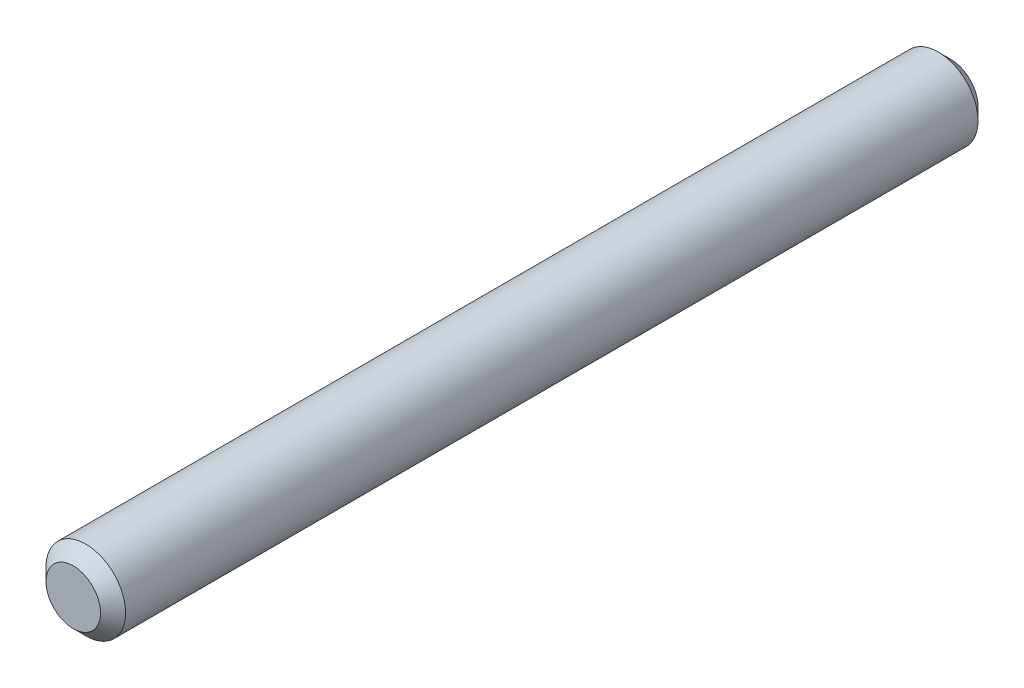
from build123d import *

# Parameters (mm, degrees)
SKETCH1_R           = 3.175
BOSS_EXTRUDE1_DEPTH = 70
CHAMFER1_SIZE       = 1


with BuildPart() as part:
    # Sketch1 → Boss-Extrude1 (new body)
    with BuildSketch(Plane.XY):
        Circle(SKETCH1_R)
    extrude(amount=-BOSS_EXTRUDE1_DEPTH)

    # Chamfer1
    chamfer1_edges = [part.edges().sort_by_distance(p)[0] for p in [
        (-3.175, 0, -70),
        (-3.175, 0, 0),
    ]]
    chamfer(chamfer1_edges, length=CHAMFER1_SIZE)


solid = part.part
